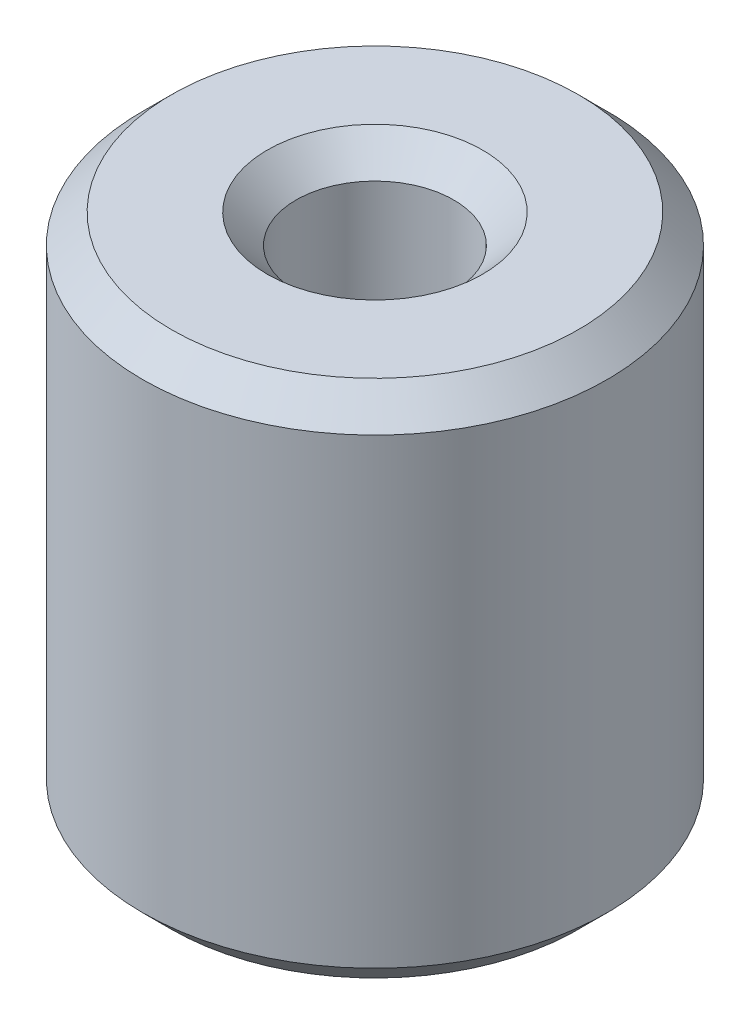
from build123d import *

# Parameters (mm, degrees)
SKETCH1_R           = 5
BOSS_EXTRUDE1_DEPTH = 11.176476414
SKETCH2_R           = 1.696827997
CUT_EXTRUDE1_DEPTH  = 14.225491486
CHAMFER1_SIZE       = 0.620153494


with BuildPart() as part:
    # Sketch1 → Boss-Extrude1 (new body)
    with BuildSketch(Plane(origin=(0, 0, 0), x_dir=(1, 0, 0), z_dir=(0, 1, 0))):
        Circle(SKETCH1_R)
    extrude(amount=BOSS_EXTRUDE1_DEPTH)

    # Sketch2 → Cut-Extrude1 (cut, through all)
    with BuildSketch(Plane(origin=(0, 0, 0), x_dir=(1, 0, 0), z_dir=(0, 1, 0))):
        Circle(SKETCH2_R)
    extrude(amount=CUT_EXTRUDE1_DEPTH, mode=Mode.SUBTRACT)

    # Chamfer1
    chamfer1_edges = [part.edges().sort_by_distance(p)[0] for p in [
        (-1.696827997, 11.176476414, 0),
        (-1.696827997, 0, 0),
        (-5, 0, 0),
        (-5, 11.176476414, 0),
    ]]
    chamfer(chamfer1_edges, length=CHAMFER1_SIZE)


solid = part.part
